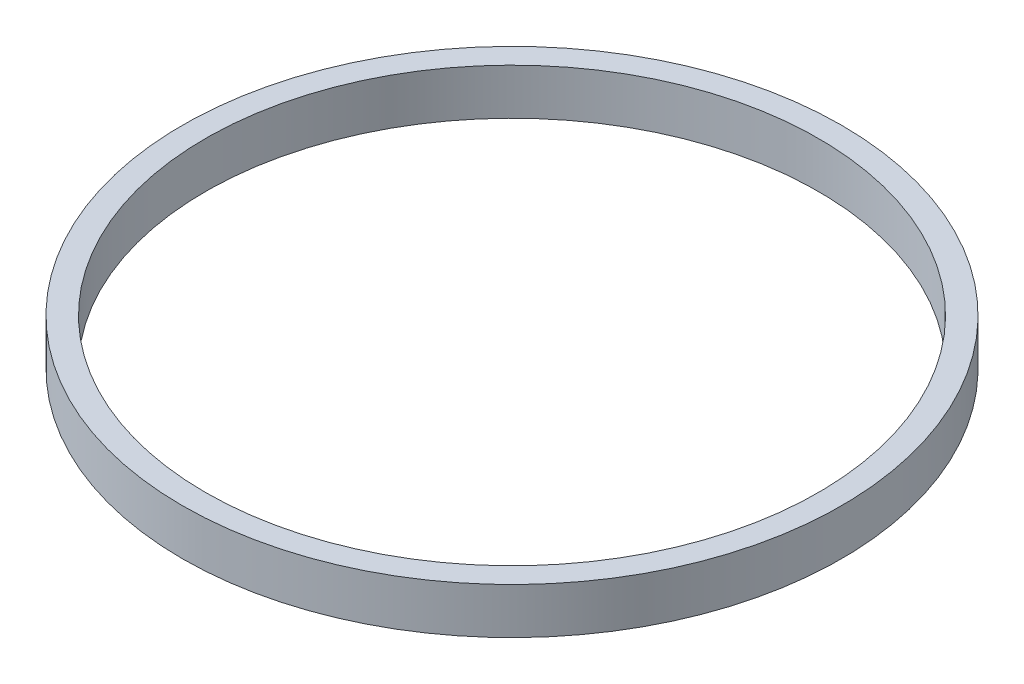
from build123d import *

# Parameters (mm, degrees)
SKETCH_1_R      = 21.5
SKETCH_1_R_2    = 20
EXTRUDE_1_DEPTH = 3


with BuildPart() as part:
    # Эскиз1 → Бобышка-Вытянуть1 (new body)
    with BuildSketch(Plane(origin=(0, 0, 0), x_dir=(1, 0, 0), z_dir=(0, 1, 0))):
        Circle(SKETCH_1_R)
        Circle(SKETCH_1_R_2, mode=Mode.SUBTRACT)
    extrude(amount=EXTRUDE_1_DEPTH)


solid = part.part
